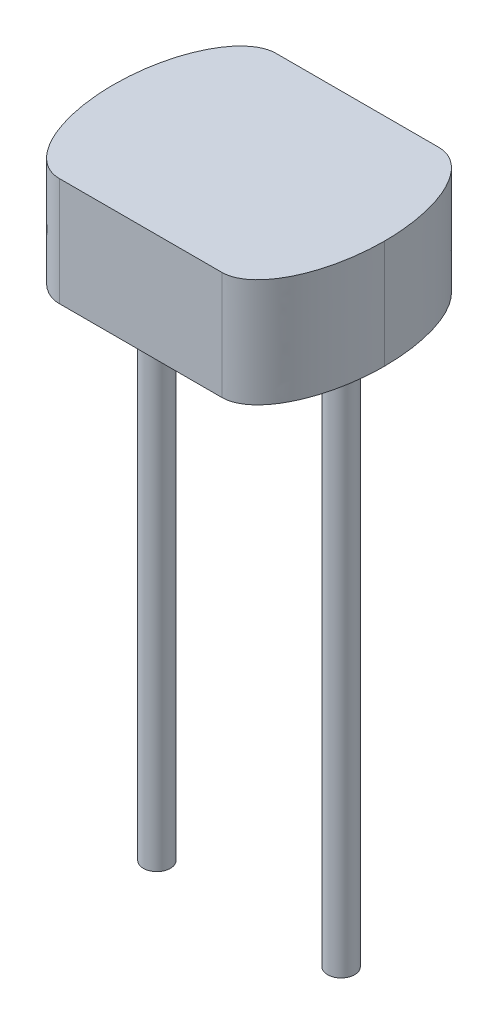
from build123d import *

# Parameters (mm, degrees)
SKETCH1_W           = 5
SKETCH1_H           = 4
BOSS_EXTRUDE1_DEPTH = 2
SKETCH2_R           = 0.25
BOSS_EXTRUDE2_DEPTH = 10
FILLET1_SIZE        = 2
FILLET1_SIZE_2      = 1
FILLET2_SIZE        = 1
FILLET2_SIZE_2      = 2


with BuildPart() as part:
    # Sketch1 → Boss-Extrude1 (new body)
    with BuildSketch(Plane(origin=(0, 0, 0), x_dir=(1, 0, 0), z_dir=(0, 1, 0))):
        Rectangle(SKETCH1_W, SKETCH1_H)
    extrude(amount=BOSS_EXTRUDE1_DEPTH)

    # Sketch2 → Boss-Extrude2 (add)
    with BuildSketch(Plane.XZ):
        with Locations(Location((-1.7, 0, 0), (0, 0, 270))):
            Circle(SKETCH2_R)
        with Locations(Location((1.7, 0, 0), (0, 0, 90))):
            Circle(SKETCH2_R)
    extrude(amount=BOSS_EXTRUDE2_DEPTH)

    # Fillet1
    # an asymmetric fillet: 2, 1 mm, written as the material it takes off along each edge
    with BuildSketch(Plane(origin=(-2.5, -5, -2), x_dir=(0, 0, 1), z_dir=(0, 1, 0))) as fillet1_piece_1:
        with BuildLine():
            Bezier((FILLET1_SIZE, 0), (0, 0), (0, FILLET1_SIZE_2), weights=[1, 0.707106781, 1])
            Line((0, FILLET1_SIZE_2), (0, 0))
            Line((0, 0), (FILLET1_SIZE, 0))
        make_face()
    extrude(amount=12, mode=Mode.SUBTRACT)
    with BuildSketch(Plane(origin=(2.5, -5, 2), x_dir=(-1, 0, 0), z_dir=(0, 1, 0))) as fillet1_piece_2:
        with BuildLine():
            Bezier((FILLET1_SIZE_2, 0), (0, 0), (0, -FILLET1_SIZE), weights=[1, 0.707106781, 1])
            Line((0, -FILLET1_SIZE), (0, 0))
            Line((0, 0), (FILLET1_SIZE_2, 0))
        make_face()
    extrude(amount=12, mode=Mode.SUBTRACT)

    # Fillet2
    # an asymmetric fillet: 2, 1 mm, written as the material it takes off along each edge
    with BuildSketch(Plane(origin=(-2.5, -5, 2), x_dir=(1, 0, 0), z_dir=(0, 1, 0)), Plane(origin=(2.5, -5, -2), x_dir=(-1, 0, 0), z_dir=(0, 1, 0))) as fillet2_piece_1:
        with BuildLine():
            Bezier((FILLET2_SIZE, 0), (0, 0), (0, FILLET2_SIZE_2), weights=[1, 0.707106781, 1])
            Line((0, FILLET2_SIZE_2), (0, 0))
            Line((0, 0), (FILLET2_SIZE, 0))
        make_face()
    extrude(amount=12, mode=Mode.SUBTRACT)


solid = part.part
